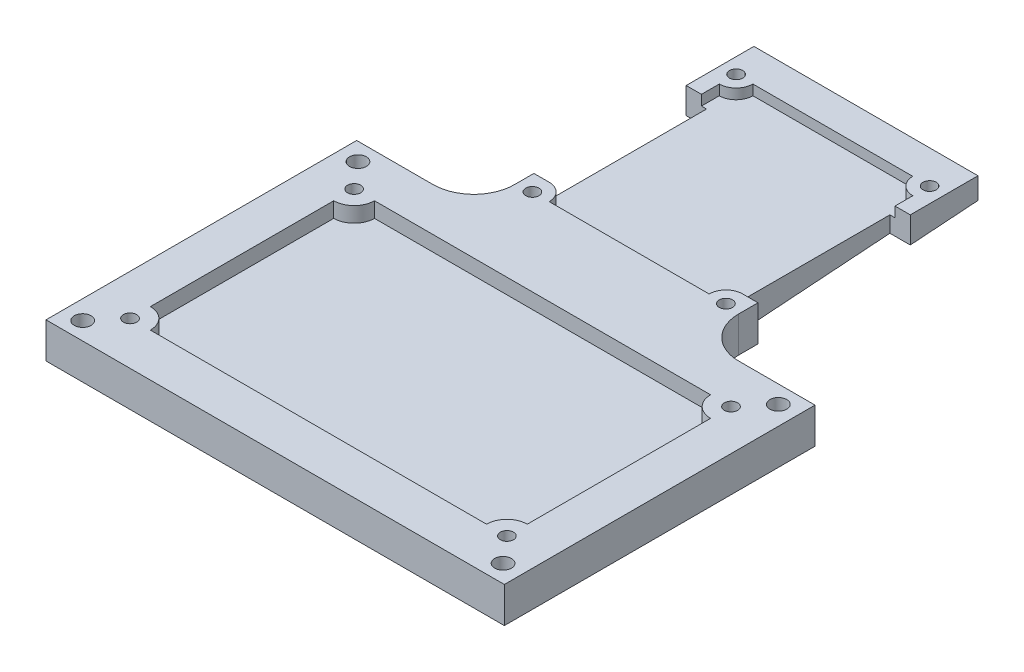
from build123d import *

# Parameters (mm, degrees)
SKETCH1_R           = 1.65
BOSS_EXTRUDE1_DEPTH = 7
CHAMFER1_SIZE       = 40
CHAMFER1_SIZE2      = 2.797072478
SKETCH2_R           = 1.3
CUT_EXTRUDE1_DEPTH  = 147.986393928
SKETCH3_R           = 1.3
CUT_EXTRUDE2_DEPTH  = 147.986393928
CUT_EXTRUDE3_DEPTH  = 3
CUT_EXTRUDE4_DEPTH  = 2
SKETCH6_W           = 4
SKETCH6_H           = 29.9
CUT_EXTRUDE5_DEPTH  = 147.986393928


with BuildPart() as part:
    # Sketch1 → Boss-Extrude1 (new body)
    with BuildSketch(Plane(origin=(0, 0, 0), x_dir=(1, 0, 0), z_dir=(0, 1, 0))):
        with BuildLine():
            Line((0, 0), (90, 0))
            Line((90, 0), (90, 61))
            Line((90, 61), (75, 61))
            ThreePointArc((75, 61), (69.343145751, 63.343145751), (67, 69))
            Line((67, 69), (67, 116))
            Line((67, 116), (23, 116))
            Line((23, 116), (23, 69))
            ThreePointArc((23, 69), (20.656854249, 63.343145751), (15, 61))
            Line((15, 61), (0, 61))
            Line((0, 61), (0, 0))
        make_face()
        with Locations((3.725, 57.525)):
            Circle(SKETCH1_R, mode=Mode.SUBTRACT)
        with Locations((86.275, 57.525)):
            Circle(SKETCH1_R, mode=Mode.SUBTRACT)
        with Locations((86.275, 3.475)):
            Circle(SKETCH1_R, mode=Mode.SUBTRACT)
        with Locations((3.725, 3.475)):
            Circle(SKETCH1_R, mode=Mode.SUBTRACT)
    extrude(amount=BOSS_EXTRUDE1_DEPTH)

    # Chamfer1
    chamfer1_edges = [part.edges().sort_by_distance(p)[0] for p in [
        (45, 0, -116),
    ]]
    chamfer1_side = [part.faces().sort_by_distance(p)[0] for p in [
        (45, 0, -48.371984874),
    ]]
    chamfer(chamfer1_edges, length=CHAMFER1_SIZE, length2=CHAMFER1_SIZE2, reference=chamfer1_side[0])

    # Sketch2 → Cut-Extrude1 (cut, through all)
    with BuildSketch(Plane(origin=(0, 7, 0), x_dir=(1, 0, 0), z_dir=(0, 1, 0))):
        with Locations((8, 52.5)):
            Circle(SKETCH2_R)
        with Locations((8, 8.5)):
            Circle(SKETCH2_R)
        with Locations((82, 52.5)):
            Circle(SKETCH2_R)
        with Locations((82, 8.5)):
            Circle(SKETCH2_R)
    extrude(amount=-CUT_EXTRUDE1_DEPTH, mode=Mode.SUBTRACT)

    # Sketch3 → Cut-Extrude2 (cut, through all)
    with BuildSketch(Plane(origin=(0, 7, 0), x_dir=(1, 0, 0), z_dir=(0, 1, 0))):
        with Locations((26, 109.5)):
            Circle(SKETCH3_R)
        with Locations((64, 109.5)):
            Circle(SKETCH3_R)
        with Locations((26, 69.5)):
            Circle(SKETCH3_R)
        with Locations((64, 69.5)):
            Circle(SKETCH3_R)
    extrude(amount=-CUT_EXTRUDE2_DEPTH, mode=Mode.SUBTRACT)

    # Sketch4 → Cut-Extrude3 (cut)
    with BuildSketch(Plane(origin=(0, 7, 0), x_dir=(1, 0, 0), z_dir=(0, 1, 0))):
        with BuildLine():
            Line((12, 52.5), (78, 52.5))
            ThreePointArc((78, 52.5), (79.171572875, 49.671572875), (82, 48.5))
            Line((82, 48.5), (82, 12.5))
            ThreePointArc((82, 12.5), (79.171572875, 11.328427125), (78, 8.5))
            Line((78, 8.5), (12, 8.5))
            ThreePointArc((12, 8.5), (10.828427125, 11.328427125), (8, 12.5))
            Line((8, 12.5), (8, 48.5))
            ThreePointArc((8, 48.5), (10.828427125, 49.671572875), (12, 52.5))
        make_face()
    extrude(amount=-CUT_EXTRUDE3_DEPTH, mode=Mode.SUBTRACT)

    # Sketch5 → Cut-Extrude4 (cut)
    with BuildSketch(Plane(origin=(0, 7, 0), x_dir=(1, 0, 0), z_dir=(0, 1, 0))):
        with BuildLine():
            Line((29.3, 109.5), (60.7, 109.5))
            ThreePointArc((60.7, 109.5), (61.666547622, 107.166547622), (64, 106.2))
            Line((64, 106.2), (64, 72.8))
            ThreePointArc((64, 72.8), (61.666547622, 71.833452378), (60.7, 69.5))
            Line((60.7, 69.5), (29.3, 69.5))
            ThreePointArc((29.3, 69.5), (28.333452378, 71.833452378), (26, 72.8))
            Line((26, 72.8), (26, 106.2))
            ThreePointArc((26, 106.2), (28.333452378, 107.166547622), (29.3, 109.5))
        make_face()
    extrude(amount=-CUT_EXTRUDE4_DEPTH, mode=Mode.SUBTRACT)

    # Sketch6 → Cut-Extrude5 (cut, through all)
    with BuildSketch(Plane(origin=(0, 7, 0), x_dir=(1, 0, 0), z_dir=(0, 1, 0))):
        with Locations((25, 87.75)):
            Rectangle(SKETCH6_W, SKETCH6_H)
        with Locations((65, 87.75)):
            Rectangle(SKETCH6_W, SKETCH6_H)
    extrude(amount=-CUT_EXTRUDE5_DEPTH, mode=Mode.SUBTRACT)


solid = part.part
